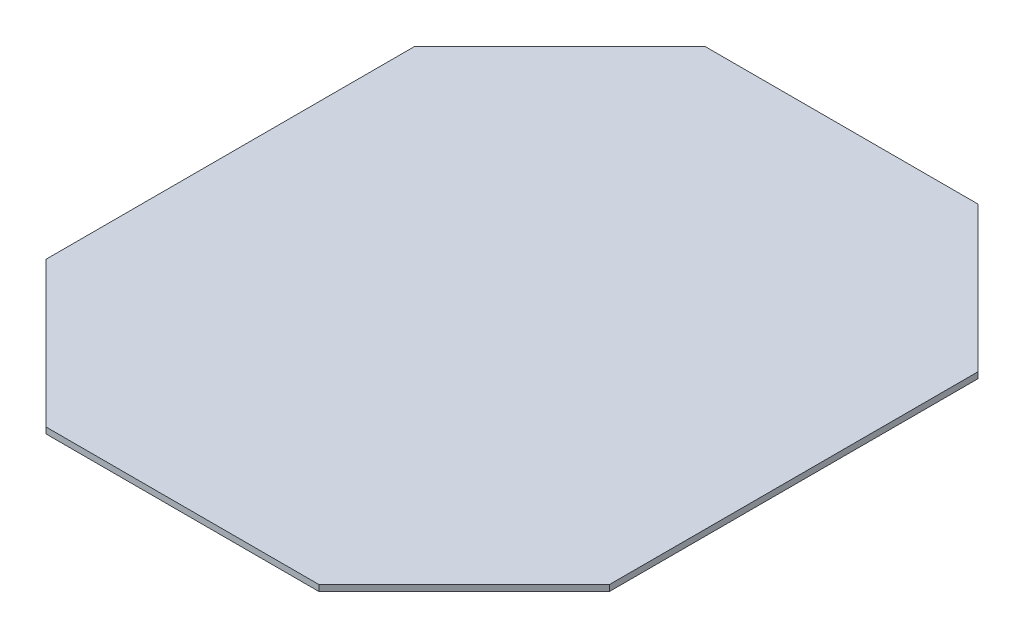
from build123d import *

# Parameters (mm, degrees)
BOSS_EXTRUDE2_DEPTH = 4.12
CUT_EXTRUDE2_DEPTH  = 4.12
CUT_EXTRUDE3_DEPTH  = 4.12


with BuildPart() as part:
    # Sketch14 → Boss-Extrude2 (new body)
    with BuildSketch(Plane(origin=(0, 0, 0), x_dir=(1, 0, 0), z_dir=(0, 1, 0))):
        Polygon((224, 92.783837972), (92.783837972, 224), (-92.783837972, 224), (-224, 92.783837972), (-224, -92.783837972), (-92.783837972, -224), (92.783837972, -224), (224, -92.783837972), align=None)
    extrude(amount=BOSS_EXTRUDE2_DEPTH)

    # Sketch17 → Cut-Extrude2 (cut)
    with BuildSketch(Plane.XZ):
        Polygon((191.5, 125.283837972), (191.5, -125.741978826), (224, -92.783837972), (224, 92.783837972), align=None)
    extrude(amount=-CUT_EXTRUDE2_DEPTH, mode=Mode.SUBTRACT)

    # Sketch18 → Cut-Extrude3 (cut)
    with BuildSketch(Plane.XZ):
        Polygon((-191.5, 125.283837972), (-224, 92.783837972), (-224, -92.783837972), (-191.5, -125.283837972), align=None)
    extrude(amount=-CUT_EXTRUDE3_DEPTH, mode=Mode.SUBTRACT)


solid = part.part
